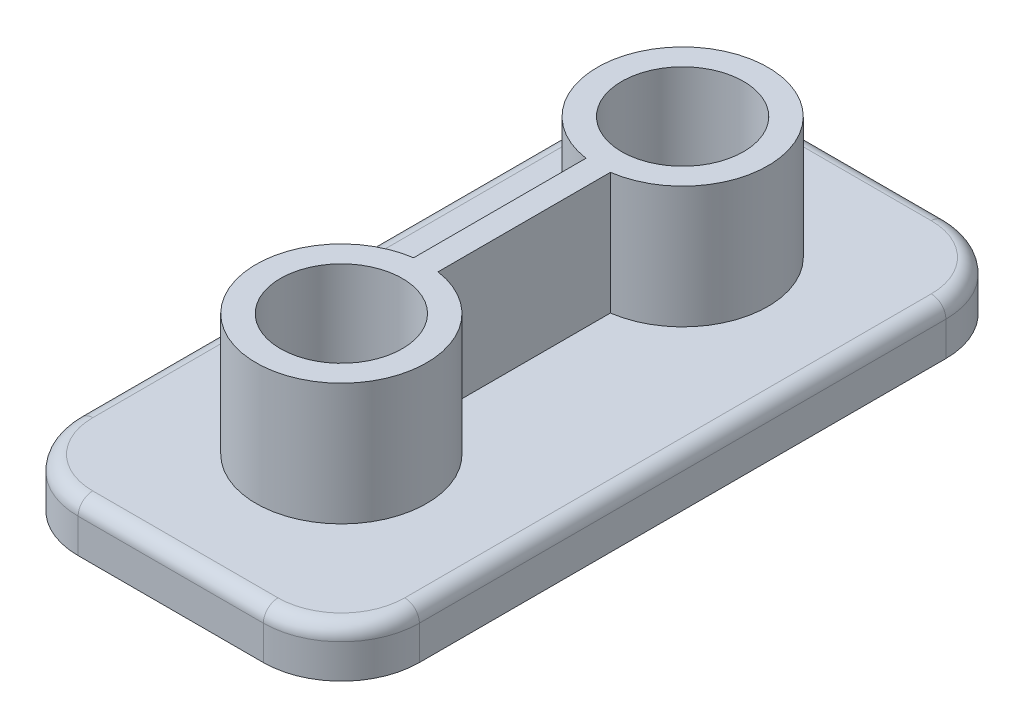
from build123d import *

# Parameters (mm, degrees)
SKETCH_2_W          = 70
SKETCH_2_H          = 10
EXTRUDE_1_DEPTH     = 140
SKETCH_8_R          = 17.5
EXTRUDE_3_DEPTH     = 25
SKETCH_9_W          = 5
SKETCH_9_H          = 62.961804642
EXTRUDE_2_DEPTH     = 25
SKETCH_10_R         = 12.5
CUT_EXTRUDE_1_DEPTH = 94
FILLET_1_R          = 16
FILLET_2_R          = 3


with BuildPart() as part:
    # 스케치2 → Extrude 1 (new body)
    with BuildSketch(Plane.XY):
        with Locations((15.828025478, -5)):
            Rectangle(SKETCH_2_W, SKETCH_2_H)
    extrude(amount=EXTRUDE_1_DEPTH)

    # 스케치8 → 보스-돌출3 (add)
    with BuildSketch(Plane(origin=(0, 0, 0), x_dir=(1, 0, 0), z_dir=(0, 1, 0))):
        with Locations((15.828025478, -35)):
            Circle(SKETCH_8_R)
        with Locations((15.828025478, -105)):
            Circle(SKETCH_8_R)
    extrude(amount=EXTRUDE_3_DEPTH)

    # 스케치9 → Extrude 2 (add)
    with BuildSketch(Plane(origin=(0, 0, 0), x_dir=(1, 0, 0), z_dir=(0, 1, 0))):
        with Locations((15.828025478, -69.77028253)):
            Rectangle(SKETCH_9_W, SKETCH_9_H)
    extrude(amount=EXTRUDE_2_DEPTH)

    # 스케치10 → 컷-돌출1 (cut)
    with BuildSketch(Plane(origin=(0, 25, 0), x_dir=(1, 0, 0), z_dir=(0, 1, 0))):
        with Locations((15.828025478, -35)):
            Circle(SKETCH_10_R)
        with Locations((15.828025478, -105)):
            Circle(SKETCH_10_R)
    extrude(amount=-CUT_EXTRUDE_1_DEPTH, mode=Mode.SUBTRACT)

    # 필렛1
    fillet_1_edges = [part.edges().sort_by_distance(p)[0] for p in [
        (50.828025478, -5, 0),
        (50.828025478, -5, 140),
        (-19.171974522, -5, 140),
        (-19.171974522, -5, 0),
    ]]
    fillet(fillet_1_edges, radius=FILLET_1_R)

    # 필렛2
    fillet_2_edges = [part.edges().sort_by_distance(p)[0] for p in [
        (50.828025478, 0, 70),
        (46.141733977, 0, 4.686291501),
        (15.828025478, 0, 0),
        (-14.485683021, 0, 4.686291501),
        (-19.171974522, 0, 70),
        (-14.485683021, 0, 135.313708499),
        (15.828025478, 0, 140),
        (46.141733977, 0, 135.313708499),
    ]]
    fillet(fillet_2_edges, radius=FILLET_2_R)


solid = part.part
